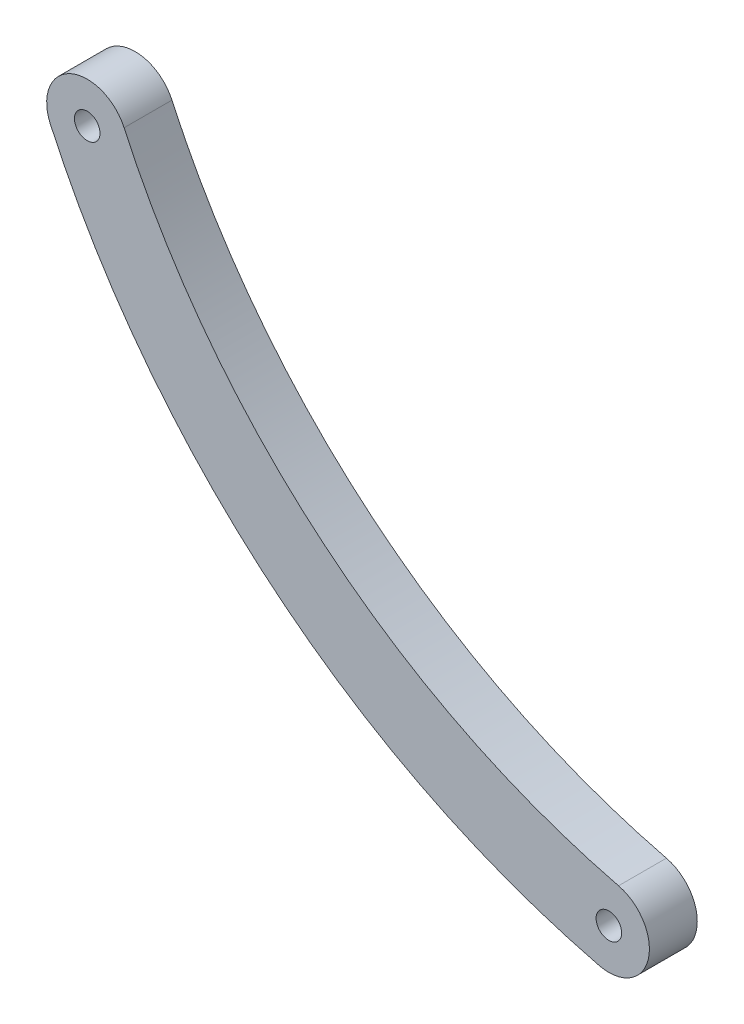
from build123d import *

# Parameters (mm, degrees)
SKETCH1_R           = 1.599999975
SKETCH1_R_2         = 1.6
BOSS_EXTRUDE1_DEPTH = 5.9944


with BuildPart() as part:
    # Sketch1 → Boss-Extrude1 (new body)
    with BuildSketch(Plane.XY):
        with BuildLine():
            ThreePointArc((149.106913007, 165.712250829), (176.970639838, 129.383442355), (217.866778032, 108.800063654))
            ThreePointArc((217.866778032, 108.800063654), (224.013099869, 112.519677596), (220.293485927, 118.665999433))
            ThreePointArc((220.293485927, 118.665999433), (183.448832542, 137.210230923), (158.345499993, 169.940029265))
            ThreePointArc((158.345499993, 169.940029265), (151.612317282, 172.44543354), (149.106913007, 165.712250829))
        make_face()
        with Locations((219.08013198, 113.733031543)):
            Circle(SKETCH1_R, mode=Mode.SUBTRACT)
        with Locations((153.7262065, 167.826140047)):
            Circle(SKETCH1_R_2, mode=Mode.SUBTRACT)
    extrude(amount=BOSS_EXTRUDE1_DEPTH)


solid = part.part
